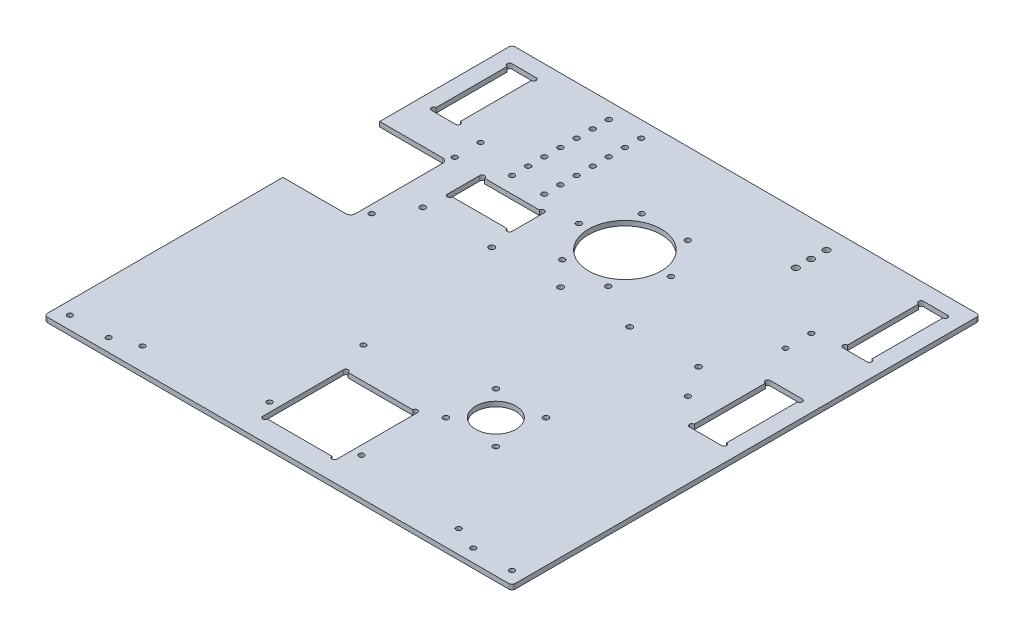
from build123d import *

# Parameters (mm, degrees)
SKETCH_1_W               = 290
SKETCH_1_H               = 290
EXTRUDE_1_DEPTH          = 3
FILLET_1_R               = 2
CUT_EXTRUDE_4_REACH      = 207.083
SKETCH_5_R               = 12.5
SKETCH_12_W              = 46
SKETCH_12_H              = 50
CUT_EXTRUDE_6_DEPTH      = 3
SKETCH_14_R              = 1.6
CUT_EXTRUDE_7_DEPTH      = 3
SKETCH_16_R              = 1.6
CUT_EXTRUDE_8_DEPTH      = 3
CUT_EXTRUDE_9_REACH      = 207.083
SKETCH_17_R              = 1.6
HOLE_WIZARD_1_D          = 3.3
HOLE_WIZARD_2_D          = 45
PATTERN_CIRCULAR_2_COUNT = 6
CUT_EXTRUDE_10_REACH     = 207.083
SKETCH_23_R              = 1.6
HOLE_WIZARD_4_D          = 3.5
CUT_EXTRUDE_12_REACH     = 207.083
SKETCH_29_W              = 42
SKETCH_29_H              = 60
FILLET_2_R               = 3
HOLE_WIZARD_5_D          = 4
HOLE_WIZARD_6_D          = 4
SKETCH_35_W              = 15
SKETCH_35_H              = 50
CUT_EXTRUDE_13_DEPTH     = 10
SKETCH_36_W              = 20
SKETCH_36_H              = 50
CUT_EXTRUDE_14_DEPTH     = 10
HOLE_WIZARD_7_D          = 3.3
PATTERN_LINEAR_1_COUNT   = 7
PATTERN_LINEAR_1_PITCH   = 10
SKETCH_40_W              = 40
SKETCH_40_H              = 20
CUT_EXTRUDE_15_DEPTH     = 10
HOLE_WIZARD_8_DEPTH      = 3
CUT_EXTRUDE_16_REACH     = 207.083
SKETCH_45_R              = 1.7


# Read off the part's stored shape, not the designer's step: 孔8
with BuildPart() as part:
    # 草图1 → 凸台-拉伸1 (new body)
    with BuildSketch(Plane(origin=(0, 0, 0), x_dir=(1, 0, 0), z_dir=(0, 1, 0))):
        Rectangle(SKETCH_1_W, SKETCH_1_H)
    extrude(amount=EXTRUDE_1_DEPTH)

    # 圆角1
    fillet_1_edges = [part.edges().sort_by_distance(p)[0] for p in [
        (145, 1.5, 145),
        (-145, 1.5, 145),
        (-145, 1.5, -145),
        (145, 1.5, -145),
    ]]
    fillet(fillet_1_edges, radius=FILLET_1_R)

    # 草图5 → 切除-拉伸4 (cut, up to next)
    with BuildSketch(Plane(origin=(0, 3, 0), x_dir=(1, 0, 0), z_dir=(0, 1, 0)), mode=Mode.PRIVATE) as cut_extrude_4_sk1:
        with Locations(Location((50, -60, 0), (0, 0, 270))):
            Circle(SKETCH_5_R)
    cut_extrude_4_tool1 = extrude(cut_extrude_4_sk1.sketch, amount=-CUT_EXTRUDE_4_REACH, mode=Mode.PRIVATE) & part.part
    add(cut_extrude_4_tool1.solids().sort_by_distance((50, 3, 60))[0], mode=Mode.SUBTRACT)

    # 草图12 → 切除-拉伸6 (cut)
    with BuildSketch(Plane(origin=(0, 3, 0), x_dir=(1, 0, 0), z_dir=(0, 1, 0))):
        with Locations((0, -106.5)):
            Rectangle(SKETCH_12_W, SKETCH_12_H)
    extrude(amount=-CUT_EXTRUDE_6_DEPTH, mode=Mode.SUBTRACT)

    # 草图14 → 切除-拉伸7 (cut)
    with BuildSketch(Plane(origin=(0, 3, 0), x_dir=(1, 0, 0), z_dir=(0, 1, 0))):
        with Locations(Location((98, 11, 0), (0, 0, 270))):
            Circle(SKETCH_14_R)
        with Locations(Location((98, -131, 0), (0, 0, 270))):
            Circle(SKETCH_14_R)
        with Locations(Location((-98, -131, 0), (0, 0, 270))):
            Circle(SKETCH_14_R)
        with Locations(Location((-98, 11, 0), (0, 0, 270))):
            Circle(SKETCH_14_R)
    extrude(amount=-CUT_EXTRUDE_7_DEPTH, mode=Mode.SUBTRACT)

    # 草图16 → 切除-拉伸8 (cut)
    with BuildSketch(Plane(origin=(0, 3, 0), x_dir=(1, 0, 0), z_dir=(0, 1, 0))):
        with Locations(Location((-28.5, -121.8, 0), (0, 0, 270))):
            Circle(SKETCH_16_R)
        with Locations(Location((28.5, -121.8, 0), (0, 0, 270))):
            Circle(SKETCH_16_R)
    extrude(amount=-CUT_EXTRUDE_8_DEPTH, mode=Mode.SUBTRACT)

    # 草图17 → 切除-拉伸9 (cut, up to next)
    with BuildSketch(Plane(origin=(0, 3, 0), x_dir=(1, 0, 0), z_dir=(0, 1, 0)), mode=Mode.PRIVATE) as cut_extrude_9_sk1:
        with Locations(Location((-137, -137, 0), (0, 0, 270))):
            Circle(SKETCH_17_R)
    cut_extrude_9_tool1 = extrude(cut_extrude_9_sk1.sketch, amount=-CUT_EXTRUDE_9_REACH, mode=Mode.PRIVATE) & part.part
    # 草图17 → 切除-拉伸9 (cut, up to next)
    with BuildSketch(Plane(origin=(0, 3, 0), x_dir=(1, 0, 0), z_dir=(0, 1, 0)), mode=Mode.PRIVATE) as cut_extrude_9_sk2:
        with Locations(Location((-113, -137, 0), (0, 0, 270))):
            Circle(SKETCH_17_R)
    cut_extrude_9_tool2 = extrude(cut_extrude_9_sk2.sketch, amount=-CUT_EXTRUDE_9_REACH, mode=Mode.PRIVATE) & part.part
    # 草图17 → 切除-拉伸9 (cut, up to next)
    with BuildSketch(Plane(origin=(0, 3, 0), x_dir=(1, 0, 0), z_dir=(0, 1, 0)), mode=Mode.PRIVATE) as cut_extrude_9_sk3:
        with Locations(Location((-102.5, 83, 0), (0, 0, 270))):
            Circle(SKETCH_17_R)
    cut_extrude_9_tool3 = extrude(cut_extrude_9_sk3.sketch, amount=-CUT_EXTRUDE_9_REACH, mode=Mode.PRIVATE) & part.part
    # 草图17 → 切除-拉伸9 (cut, up to next)
    with BuildSketch(Plane(origin=(0, 3, 0), x_dir=(1, 0, 0), z_dir=(0, 1, 0)), mode=Mode.PRIVATE) as cut_extrude_9_sk4:
        with Locations(Location((-102.5, 67, 0), (0, 0, 270))):
            Circle(SKETCH_17_R)
    cut_extrude_9_tool4 = extrude(cut_extrude_9_sk4.sketch, amount=-CUT_EXTRUDE_9_REACH, mode=Mode.PRIVATE) & part.part
    cut_extrude_9_1 = cut_extrude_9_tool1.solids().sort_by_distance((-137, 3, 137))[0]
    add(cut_extrude_9_1, mode=Mode.SUBTRACT)
    cut_extrude_9_2 = cut_extrude_9_tool2.solids().sort_by_distance((-113, 3, 137))[0]
    add(cut_extrude_9_2, mode=Mode.SUBTRACT)
    cut_extrude_9_3 = cut_extrude_9_tool3.solids().sort_by_distance((-102.5, 3, -83))[0]
    add(cut_extrude_9_3, mode=Mode.SUBTRACT)
    cut_extrude_9_4 = cut_extrude_9_tool4.solids().sort_by_distance((-102.5, 3, -67))[0]
    add(cut_extrude_9_4, mode=Mode.SUBTRACT)
    cut_extrude_9 = cut_extrude_9_1 + cut_extrude_9_2 + cut_extrude_9_3 + cut_extrude_9_4  # 切除-拉伸9 as one shape, for the pattern or mirror that repeats it

    # 镜向1: 切除-拉伸9 across plane
    add(cut_extrude_9.mirror(Plane(origin=(0, 0, 0), x_dir=(0, 0, 1), z_dir=(1, 0, 0))), mode=Mode.SUBTRACT)

    # 孔1 (through all)
    with Locations(Plane(origin=(0, 3, 0), x_dir=(1, 0, 0), z_dir=(0, 1, 0))):
        with Locations((-28.5, 70)):
            hole_wizard_1 = Hole(HOLE_WIZARD_1_D / 2)

    # 孔2 (through all)
    with Locations(Plane(origin=(0, 3, 0), x_dir=(1, 0, 0), z_dir=(0, 1, 0))):
        with Locations((0, 70)):
            Hole(HOLE_WIZARD_2_D / 2)

    # 阵列(圆周)2: 孔1 ×6 about axis
    pattern_circular_2_axis = Axis((0, 0, -70), (0, 1, 0))
    for i in range(1, PATTERN_CIRCULAR_2_COUNT):
        add(hole_wizard_1.rotate(pattern_circular_2_axis, i * 360 / PATTERN_CIRCULAR_2_COUNT), mode=Mode.SUBTRACT)

    # 草图23 → 切除-拉伸10 (cut, up to next)
    with BuildSketch(Plane.XZ, mode=Mode.PRIVATE) as cut_extrude_10_sk1:
        with Locations(Location((-30, 62.1, 0), (0, 0, 270))):
            Circle(SKETCH_23_R)
    cut_extrude_10_tool1 = extrude(cut_extrude_10_sk1.sketch, amount=-CUT_EXTRUDE_10_REACH, mode=Mode.PRIVATE) & part.part
    add(cut_extrude_10_tool1.solids().sort_by_distance((-30, 0, 62.1))[0], mode=Mode.SUBTRACT)

    # 孔4 (through all)
    with Locations(Plane(origin=(0, 0, 0), x_dir=(-1, 0, 0), z_dir=(0, -1, 0))):
        with Locations((85.5, 30.18), (42.75, 30.18), (0, 30.18), (-42.75, 30.18), (-85.5, 30.18)):
            Hole(HOLE_WIZARD_4_D / 2)

    # 草图29 → 切除-拉伸12 (cut, up to next)
    with BuildSketch(Plane.XZ, mode=Mode.PRIVATE) as cut_extrude_12_sk1:
        with Locations((-124, -33)):
            Rectangle(SKETCH_29_W, SKETCH_29_H)
    cut_extrude_12_tool1 = extrude(cut_extrude_12_sk1.sketch, amount=-CUT_EXTRUDE_12_REACH, mode=Mode.PRIVATE) & part.part
    add(cut_extrude_12_tool1.solids().sort_by_distance((-124, 0, -33))[0], mode=Mode.SUBTRACT)

    # 圆角2
    fillet_2_edges = [part.edges().sort_by_distance(p)[0] for p in [
        (-103, 1.5, -3),
        (-103, 1.5, -63),
    ]]
    fillet(fillet_2_edges, radius=FILLET_2_R)

    # 孔5 (through all)
    with Locations(Plane(origin=(0, 0, 0), x_dir=(-1, 0, 0), z_dir=(0, -1, 0))):
        with Locations((-62.50000012, 132.39610106)):
            Hole(HOLE_WIZARD_5_D / 2)

    # 孔6 (through all)
    with Locations(Plane(origin=(0, 0, 0), x_dir=(-1, 0, 0), z_dir=(0, -1, 0))):
        with Locations((-62.50000012, 122.89610106), (-62.50000012, 113.39610106)):
            Hole(HOLE_WIZARD_6_D / 2)

    # 草图35 → 切除-拉伸13 (cut)
    with BuildSketch(Plane(origin=(0, 3, 0), x_dir=(1, 0, 0), z_dir=(0, 1, 0))):
        with Locations((127.5, 110)):
            Rectangle(SKETCH_35_W, SKETCH_35_H)
        with Locations((-127.5, 110)):
            Rectangle(SKETCH_35_W, SKETCH_35_H)
    extrude(amount=-CUT_EXTRUDE_13_DEPTH, mode=Mode.SUBTRACT)

    # 草图36 → 切除-拉伸14 (cut)
    with BuildSketch(Plane(origin=(0, 3, 0), x_dir=(1, 0, 0), z_dir=(0, 1, 0))):
        with Locations((125, 20)):
            Rectangle(SKETCH_36_W, SKETCH_36_H)
    extrude(amount=-CUT_EXTRUDE_14_DEPTH, mode=Mode.SUBTRACT)

    # 孔7 (through all)
    with Locations(Plane(origin=(0, 3, 0), x_dir=(1, 0, 0), z_dir=(0, 1, 0))):
        with Locations((-75, 135), (-55, 135)):
            hole_wizard_7 = Hole(HOLE_WIZARD_7_D / 2)

    # 阵列(线性)1: 孔7 ×7
    with Locations(*[(0, 0, i * PATTERN_LINEAR_1_PITCH) for i in range(1, PATTERN_LINEAR_1_COUNT)]):
        add(hole_wizard_7, mode=Mode.SUBTRACT)

    # 草图40 → 切除-拉伸15 (cut)
    with BuildSketch(Plane(origin=(0, 3, 0), x_dir=(1, 0, 0), z_dir=(0, 1, 0))):
        with Locations((-65, 55)):
            Rectangle(SKETCH_40_W, SKETCH_40_H)
    extrude(amount=-CUT_EXTRUDE_15_DEPTH, mode=Mode.SUBTRACT)

    # 孔8 outline → 孔8 (cut)
    with BuildSketch(Plane(origin=(0, 0, 0), x_dir=(1, 0, 0), z_dir=(0, 1, 0))):
        with BuildLine():
            Line((-45, 45), (-48, 45))
            ThreePointArc((-48, 45), (-46.5, 43.5), (-45, 45))
        make_face()
        with BuildLine():
            ThreePointArc((-85, 45), (-83.5, 43.5), (-82, 45))
            Line((-82, 45), (-85, 45))
        make_face()
        with BuildLine():
            Line((-85, 65), (-82, 65))
            ThreePointArc((-82, 65), (-83.5, 66.5), (-85, 65))
        make_face()
        with BuildLine():
            ThreePointArc((-45, 65), (-46.5, 66.5), (-48, 65))
            Line((-48, 65), (-45, 65))
        make_face()
        with BuildLine():
            Line((-120, 135), (-120, 132))
            ThreePointArc((-120, 132), (-118.5, 133.5), (-120, 135))
        make_face()
        with BuildLine():
            ThreePointArc((-120, 85), (-118.5, 86.5), (-120, 88))
            Line((-120, 88), (-120, 85))
        make_face()
        with BuildLine():
            ThreePointArc((-135, 135), (-136.5, 133.5), (-135, 132))
            Line((-135, 132), (-135, 135))
        make_face()
        with BuildLine():
            ThreePointArc((-135, 88), (-136.5, 86.5), (-135, 85))
            Line((-135, 85), (-135, 88))
        make_face()
        with BuildLine():
            Line((120, 85), (120, 88))
            ThreePointArc((120, 88), (118.5, 86.5), (120, 85))
        make_face()
        with BuildLine():
            ThreePointArc((120, 135), (118.5, 133.5), (120, 132))
            Line((120, 132), (120, 135))
        make_face()
        with BuildLine():
            ThreePointArc((135, 85), (136.5, 86.5), (135, 88))
            Line((135, 88), (135, 85))
        make_face()
        with BuildLine():
            ThreePointArc((135, 132), (136.5, 133.5), (135, 135))
            Line((135, 135), (135, 132))
        make_face()
        with BuildLine():
            ThreePointArc((135, -5), (136.5, -3.5), (135, -2))
            Line((135, -2), (135, -5))
        make_face()
        with BuildLine():
            ThreePointArc((135, 42), (136.5, 43.5), (135, 45))
            Line((135, 45), (135, 42))
        make_face()
        with BuildLine():
            Line((115, -5), (115, -2))
            ThreePointArc((115, -2), (113.5, -3.5), (115, -5))
        make_face()
        with BuildLine():
            ThreePointArc((115, 45), (113.5, 43.5), (115, 42))
            Line((115, 42), (115, 45))
        make_face()
        with BuildLine():
            Line((23, -131.5), (20, -131.5))
            ThreePointArc((20, -131.5), (21.5, -133), (23, -131.5))
        make_face()
        with BuildLine():
            ThreePointArc((-23, -131.5), (-21.5, -133), (-20, -131.5))
            Line((-20, -131.5), (-23, -131.5))
        make_face()
        with BuildLine():
            Line((-23, -81.5), (-20, -81.5))
            ThreePointArc((-20, -81.5), (-21.5, -80), (-23, -81.5))
        make_face()
        with BuildLine():
            ThreePointArc((23, -81.5), (21.5, -80), (20, -81.5))
            Line((20, -81.5), (23, -81.5))
        make_face()
    extrude(amount=HOLE_WIZARD_8_DEPTH, mode=Mode.SUBTRACT)

    # 草图45 → 切除-拉伸16 (cut, up to next)
    with BuildSketch(Plane(origin=(0, 3, 0), x_dir=(1, 0, 0), z_dir=(0, 1, 0)), mode=Mode.PRIVATE) as cut_extrude_16_sk1:
        with Locations(Location((65.5, -75.5, 0), (0, 0, 270))):
            Circle(SKETCH_45_R)
    cut_extrude_16_tool1 = extrude(cut_extrude_16_sk1.sketch, amount=-CUT_EXTRUDE_16_REACH, mode=Mode.PRIVATE) & part.part
    # 草图45 → 切除-拉伸16 (cut, up to next)
    with BuildSketch(Plane(origin=(0, 3, 0), x_dir=(1, 0, 0), z_dir=(0, 1, 0)), mode=Mode.PRIVATE) as cut_extrude_16_sk2:
        with Locations(Location((65.5, -44.5, 0), (0, 0, 270))):
            Circle(SKETCH_45_R)
    cut_extrude_16_tool2 = extrude(cut_extrude_16_sk2.sketch, amount=-CUT_EXTRUDE_16_REACH, mode=Mode.PRIVATE) & part.part
    # 草图45 → 切除-拉伸16 (cut, up to next)
    with BuildSketch(Plane(origin=(0, 3, 0), x_dir=(1, 0, 0), z_dir=(0, 1, 0)), mode=Mode.PRIVATE) as cut_extrude_16_sk3:
        with Locations(Location((34.5, -44.5, 0), (0, 0, 270))):
            Circle(SKETCH_45_R)
    cut_extrude_16_tool3 = extrude(cut_extrude_16_sk3.sketch, amount=-CUT_EXTRUDE_16_REACH, mode=Mode.PRIVATE) & part.part
    # 草图45 → 切除-拉伸16 (cut, up to next)
    with BuildSketch(Plane(origin=(0, 3, 0), x_dir=(1, 0, 0), z_dir=(0, 1, 0)), mode=Mode.PRIVATE) as cut_extrude_16_sk4:
        with Locations(Location((34.5, -75.5, 0), (0, 0, 270))):
            Circle(SKETCH_45_R)
    cut_extrude_16_tool4 = extrude(cut_extrude_16_sk4.sketch, amount=-CUT_EXTRUDE_16_REACH, mode=Mode.PRIVATE) & part.part
    add(cut_extrude_16_tool1.solids().sort_by_distance((65.5, 3, 75.5))[0], mode=Mode.SUBTRACT)
    add(cut_extrude_16_tool2.solids().sort_by_distance((65.5, 3, 44.5))[0], mode=Mode.SUBTRACT)
    add(cut_extrude_16_tool3.solids().sort_by_distance((34.5, 3, 44.5))[0], mode=Mode.SUBTRACT)
    add(cut_extrude_16_tool4.solids().sort_by_distance((34.5, 3, 75.5))[0], mode=Mode.SUBTRACT)


solid = part.part
